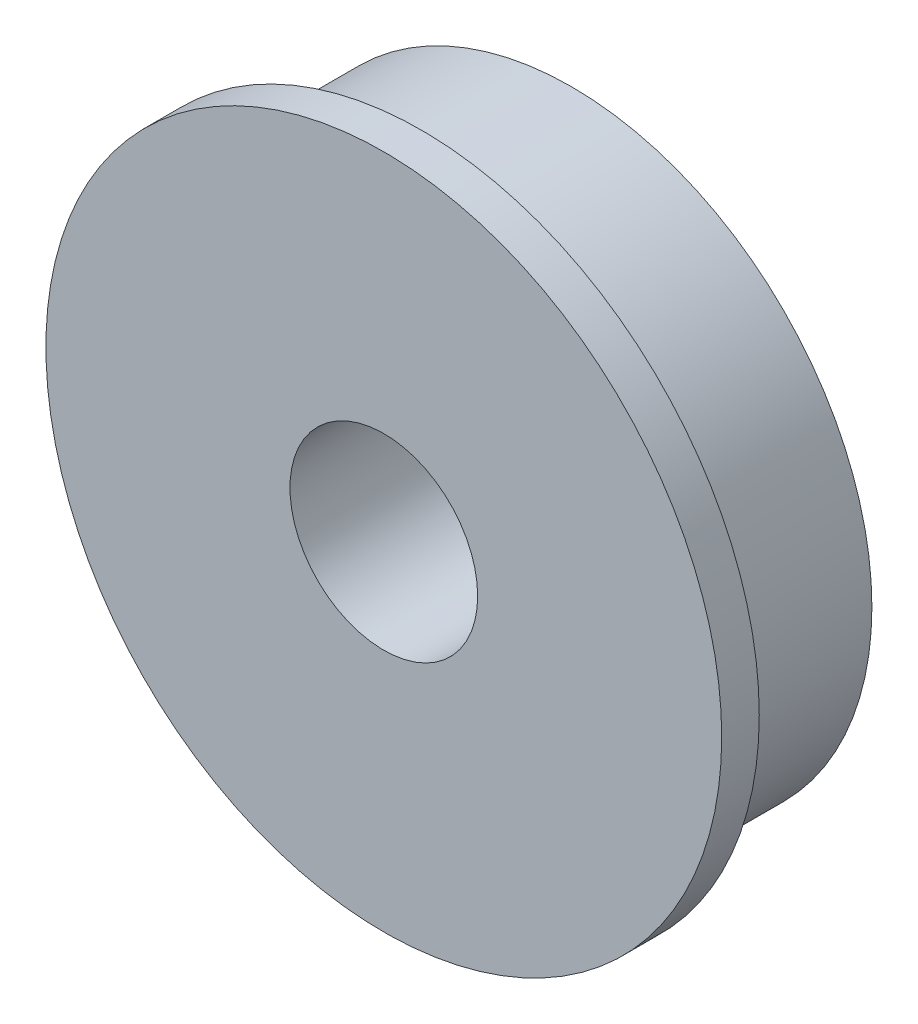
from build123d import *

# Parameters (mm, degrees)
SZKIC1_R                    = 8
SZKIC1_R_2                  = 2.5
DODANIE_WYCI_GNI_CIE1_DEPTH = 5
DODANIE_WYCI_GNI_CIE2_START = -1
SZKIC2_R                    = 9
SZKIC2_R_2                  = 8
DODANIE_WYCI_GNI_CIE2_DEPTH = 1


with BuildPart() as part:
    # Szkic1 → Dodanie-wyciągnięcie1 (new body)
    with BuildSketch(Plane.XY):
        Circle(SZKIC1_R)
        Circle(SZKIC1_R_2, mode=Mode.SUBTRACT)
    extrude(amount=DODANIE_WYCI_GNI_CIE1_DEPTH)

    # Szkic2 → Dodanie-wyciągnięcie2 (add)
    with BuildSketch(Plane.XY.offset(5).offset(DODANIE_WYCI_GNI_CIE2_START)):
        Circle(SZKIC2_R)
        Circle(SZKIC2_R_2, mode=Mode.SUBTRACT)
    extrude(amount=DODANIE_WYCI_GNI_CIE2_DEPTH)


solid = part.part
